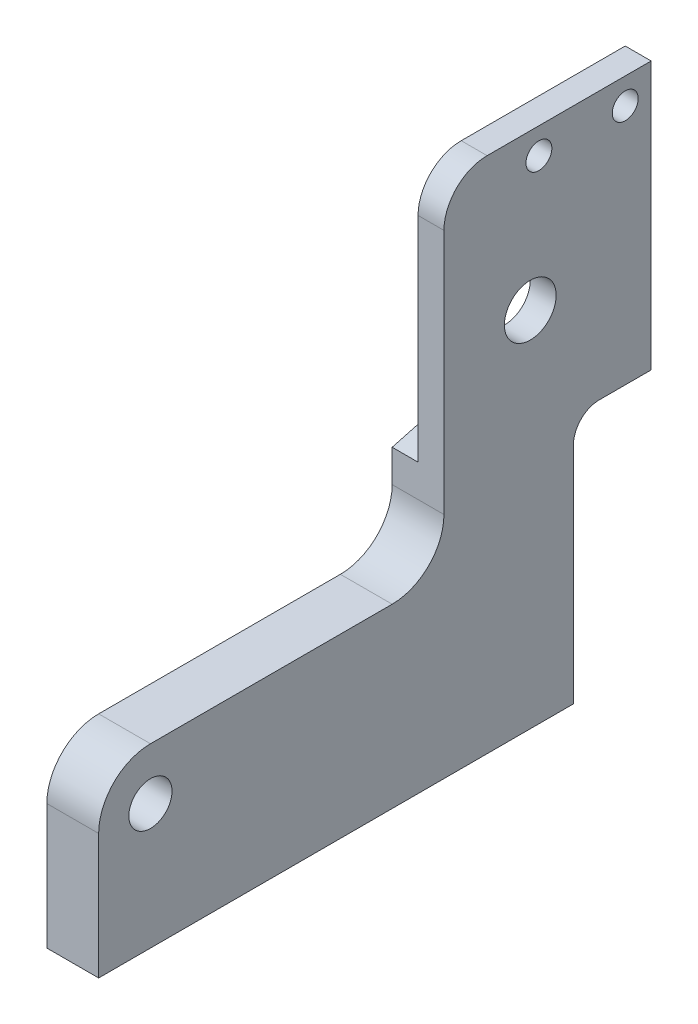
from build123d import *

# Parameters (mm, degrees)
SKETCH1_W                   = 64
SKETCH1_H                   = 60
SKETCH1_R                   = 2.5
SKETCH1_R_2                 = 3
BOSS_EXTRUDE1_DEPTH         = 6
CUT_EXTRUDE1_REACH          = 89.932
CUT_EXTRUDE2_REACH          = 89.932
SKETCH3_W                   = 9
SKETCH3_H                   = 29
FILLET1_R                   = 5
FILLET2_R                   = 3
TAP_DRILL_FOR_M3_TAP1_D     = 2.5
TAP_DRILL_FOR_M3_TAP1_DEPTH = 10
TAP_DRILL_FOR_M3_TAP1_TIP   = 0.751075774
CUT_EXTRUDE3_DEPTH          = 3
CUT_EXTRUDE4_REACH          = 89.778
SKETCH10_R                  = 1.5


with BuildPart() as part:
    # Sketch1 → Boss-Extrude1 (new body)
    with BuildSketch(Plane(origin=(0, 0, 0), x_dir=(0, 0, -1), z_dir=(1, 0, 0))):
        with Locations((32, 30)):
            Rectangle(SKETCH1_W, SKETCH1_H)
        with Locations((6, 14.5)):
            Circle(SKETCH1_R, mode=Mode.SUBTRACT)
        with Locations((50, 42)):
            Circle(SKETCH1_R_2, mode=Mode.SUBTRACT)
    extrude(amount=BOSS_EXTRUDE1_DEPTH)

    # Sketch2 → Cut-Extrude1 (cut, up to next)
    with BuildSketch(Plane(origin=(6, 0, 0), x_dir=(0, 0, -1), z_dir=(1, 0, 0)), mode=Mode.PRIVATE) as cut_extrude1_sk1:
        with BuildLine():
            Line((6, 20.5), (34, 20.5))
            ThreePointArc((34, 20.5), (38.242640687, 22.257359313), (40, 26.5))
            Line((40, 26.5), (40, 61))
            Line((40, 61), (0, 61))
            Line((0, 61), (0, 14.5))
            ThreePointArc((0, 14.5), (1.757359313, 18.742640687), (6, 20.5))
        make_face()
    cut_extrude1_tool1 = extrude(cut_extrude1_sk1.sketch, amount=-CUT_EXTRUDE1_REACH, mode=Mode.PRIVATE) & part.part
    add(cut_extrude1_tool1.solids().sort_by_distance((6, 40.737217, -19.822026))[0], mode=Mode.SUBTRACT)

    # Sketch3 → Cut-Extrude2 (cut, up to next)
    with BuildSketch(Plane(origin=(6, 0, 0), x_dir=(0, 0, -1), z_dir=(1, 0, 0)), mode=Mode.PRIVATE) as cut_extrude2_sk1:
        with Locations((59.5, 14.5)):
            Rectangle(SKETCH3_W, SKETCH3_H)
    cut_extrude2_tool1 = extrude(cut_extrude2_sk1.sketch, amount=-CUT_EXTRUDE2_REACH, mode=Mode.PRIVATE) & part.part
    add(cut_extrude2_tool1.solids().sort_by_distance((6, 14.5, -59.5))[0], mode=Mode.SUBTRACT)

    # Fillet1
    fillet1_edges = [part.edges().sort_by_distance(p)[0] for p in [
        (3, 60, -40),
    ]]
    fillet(fillet1_edges, radius=FILLET1_R)

    # Fillet2
    fillet2_edges = [part.edges().sort_by_distance(p)[0] for p in [
        (3, 29, -55),
    ]]
    fillet(fillet2_edges, radius=FILLET2_R)

    # Tap Drill for M3 Tap1
    with Locations(Plane(origin=(0, 0, 0), x_dir=(-1, 0, 0), z_dir=(0, -1, 0))):
        with Locations((-3, 48), (-3, 12)):
            Hole(TAP_DRILL_FOR_M3_TAP1_D / 2, depth=TAP_DRILL_FOR_M3_TAP1_DEPTH)
            with Locations((0, 0, -(TAP_DRILL_FOR_M3_TAP1_DEPTH + TAP_DRILL_FOR_M3_TAP1_TIP / 2))):  # 118° drill point
                Cone(0, TAP_DRILL_FOR_M3_TAP1_D / 2, TAP_DRILL_FOR_M3_TAP1_TIP, mode=Mode.SUBTRACT)

    # Sketch9 → Cut-Extrude3 (cut)
    with BuildSketch(Plane.ZY):
        Polygon((-64, 60), (-64, 34), (-54, 34), (-40, 30.248711306), (-40, 60), align=None)
    extrude(amount=-CUT_EXTRUDE3_DEPTH, mode=Mode.SUBTRACT)

    # Sketch10 → Cut-Extrude4 (cut, up to next)
    with BuildSketch(Plane.ZY.offset(-3), mode=Mode.PRIVATE) as cut_extrude4_sk1:
        with Locations((-61, 57)):
            Circle(SKETCH10_R)
    cut_extrude4_tool1 = extrude(cut_extrude4_sk1.sketch, amount=-CUT_EXTRUDE4_REACH, mode=Mode.PRIVATE) & part.part
    # Sketch10 → Cut-Extrude4 (cut, up to next)
    with BuildSketch(Plane.ZY.offset(-3), mode=Mode.PRIVATE) as cut_extrude4_sk2:
        with Locations((-51, 57)):
            Circle(SKETCH10_R)
    cut_extrude4_tool2 = extrude(cut_extrude4_sk2.sketch, amount=-CUT_EXTRUDE4_REACH, mode=Mode.PRIVATE) & part.part
    add(cut_extrude4_tool1.solids().sort_by_distance((3, 57, -61))[0], mode=Mode.SUBTRACT)
    add(cut_extrude4_tool2.solids().sort_by_distance((3, 57, -51))[0], mode=Mode.SUBTRACT)


solid = part.part
